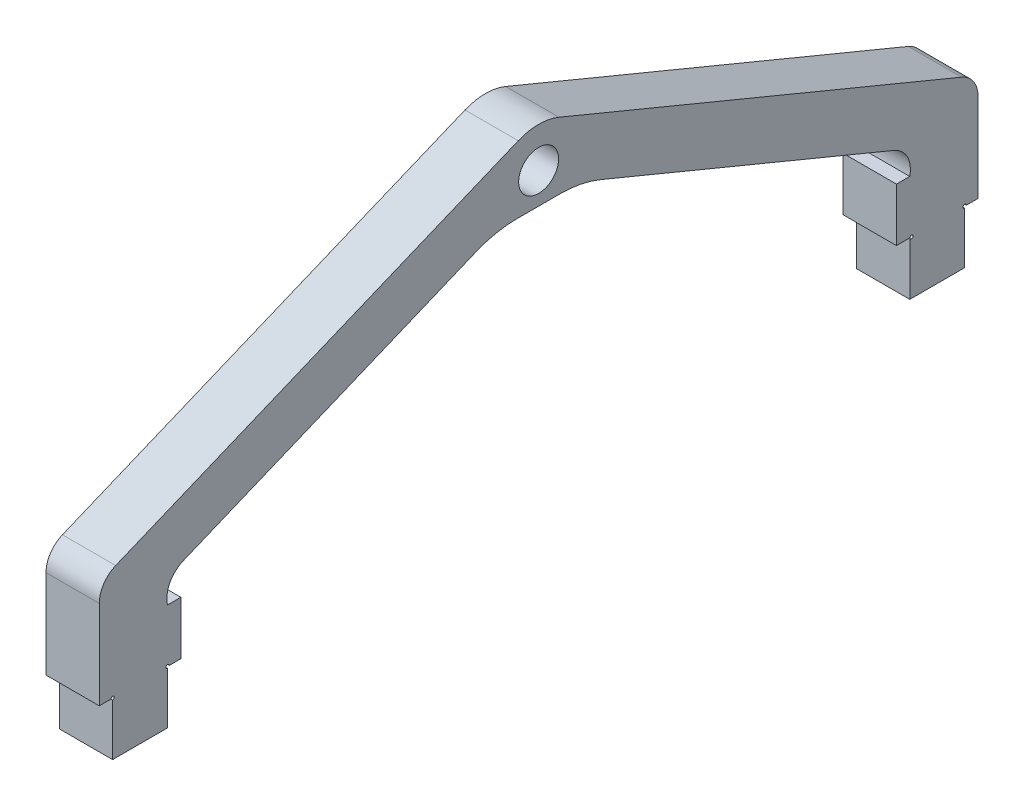
from build123d import *

# Parameters (mm, degrees)
BOSS_EXTRUDE1_DEPTH = 6.35
SKETCH2_R           = 0.1984375
CUT_EXTRUDE1_DEPTH  = 63.980878762
FILLET5_R           = 3.175
FILLET6_R           = 12.7
FILLET7_R           = 6.35
SKETCH5_R           = 2.38125
CUT_EXTRUDE6_DEPTH  = 63.697383663


with BuildPart() as part:
    # Sketch1 → Boss-Extrude1 (new body)
    with BuildSketch(Plane(origin=(0, 0, 0), x_dir=(0, 0, -1), z_dir=(1, 0, 0))):
        Polygon((50.8, -6.35), (50.8, 0), (52.3875, 0), (52.3875, 12.7), (6.35, 31.75), (0, 34.377586207), (-6.35, 31.75), (-52.3875, 12.7), (-52.3875, 0), (-50.8, 0), (-50.8, -6.35), (-44.25, -6.35), (-44.25, 0), (-42.6625, 0), (-42.6625, 6.35), (-44.25, 6.35), (-46.0375, 8.455417024), (-5.088091142, 25.4), (5.088091142, 25.4), (46.0375, 8.455417024), (44.25, 6.35), (42.6625, 6.35), (42.6625, 0), (44.25, 0), (44.25, -6.35), align=None)
    extrude(amount=BOSS_EXTRUDE1_DEPTH)

    # Sketch2 → Cut-Extrude1 (cut, through all)
    with BuildSketch(Plane(origin=(6.35, 0, 0), x_dir=(0, 0, -1), z_dir=(1, 0, 0))):
        with Locations((-50.8, 0)):
            Circle(SKETCH2_R)
        with Locations((-44.25, 0)):
            Circle(SKETCH2_R)
        with Locations(Location((44.45, 0, 0), (0, 0, 180))):
            Circle(SKETCH2_R)
        with Locations((50.8, 0)):
            Circle(SKETCH2_R)
    extrude(amount=-CUT_EXTRUDE1_DEPTH, mode=Mode.SUBTRACT)

    # Fillet5
    # the kernel refuses this fillet: 3.175 mm, written as the material it adds along each edge
    with BuildSketch(Plane(origin=(0, 8.455417024, 46.0375), x_dir=(0, 0.38235179272629993, -0.9240168324218908), z_dir=(1, 0, 0))) as fillet5_piece_1:
        with BuildLine():
            CenterArc((3.974351986, -3.175), FILLET5_R, 90, 80.095777378)
            Line((0.846670114, -2.628894599), (0, 0))
            Line((0, 0), (3.974351986, 0))
        make_face()
    extrude(amount=6.35)
    with BuildSketch(Plane(origin=(0, 8.455417024, -46.0375), x_dir=(0, -0.7623151990147004, 0.6472059466284111), z_dir=(1, 0, 0))) as fillet5_piece_2:
        with BuildLine():
            CenterArc((4.240495318, -2.80967937), FILLET5_R, 117.756060194, 80.095777378)
            Line((1.218363855, -3.782996593), (0, 0))
            Line((0, 0), (2.761872027, 0))
        make_face()
    extrude(amount=6.35)
    # the kernel refuses this fillet: 3.175 mm, written as the material it takes off along each edge
    with BuildSketch(Plane(origin=(-5.30572872, 12.7, -52.3875), x_dir=(0, -1, 0), z_dir=(1, 0, 0)), Plane(origin=(-5.30572872, 12.7, 52.3875), x_dir=(0, 0.38235179272628034, -0.9240168324218988), z_dir=(1, 0, 0))) as fillet5_2_piece_1:
        with BuildLine():
            CenterArc((FILLET5_R * 0.668438263895, -FILLET5_R), FILLET5_R, 90, 67.520565603)
            Line((-FILLET5_R * 0.255578568527, -FILLET5_R * 0.617648207274), (0, 0))
            Line((0, 0), (FILLET5_R * 0.668438263895, 0))
        make_face()
    extrude(amount=16.961457439, mode=Mode.SUBTRACT)

    # Fillet6
    fillet6_edges = [part.edges().sort_by_distance(p)[0] for p in [
        (3.175, 25.4, -5.088091142),
        (3.175, 25.4, 5.088091142),
    ]]
    fillet(fillet6_edges, radius=FILLET6_R)

    # Fillet7
    fillet7_edges = [part.edges().sort_by_distance(p)[0] for p in [
        (3.175, 34.377586207, 0),
    ]]
    fillet(fillet7_edges, radius=FILLET7_R)

    # Sketch5 → Cut-Extrude6 (cut, through all)
    with BuildSketch(Plane(origin=(6.35, 0, 0), x_dir=(0, 0, -1), z_dir=(1, 0, 0))):
        with Locations((0, 29.092917024)):
            Circle(SKETCH5_R)
    extrude(amount=-CUT_EXTRUDE6_DEPTH, mode=Mode.SUBTRACT)


solid = part.part
